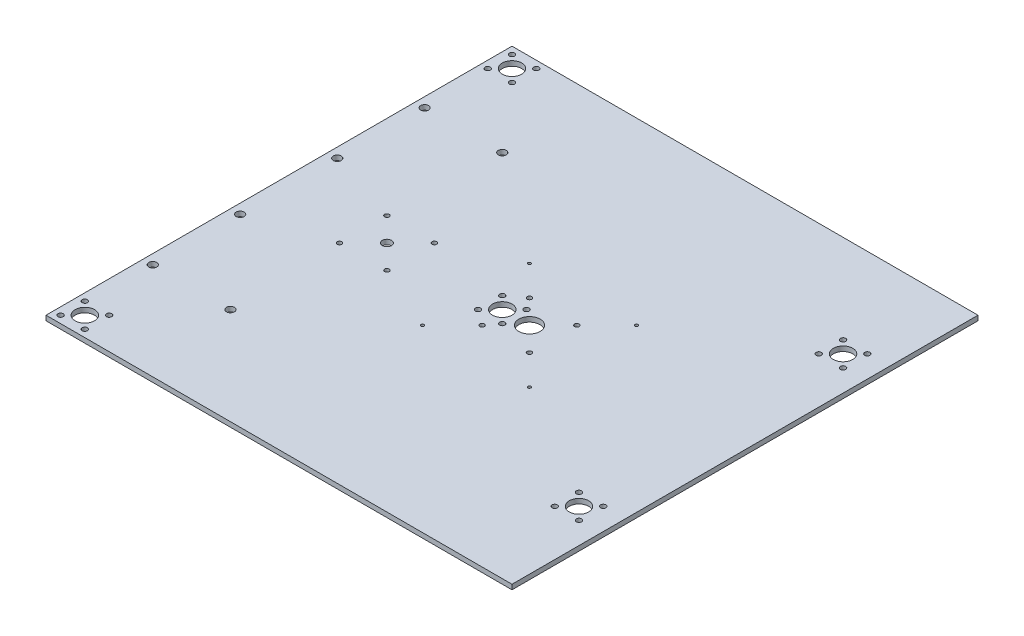
from build123d import *

# Parameters (mm, degrees)
SKETCH1_W               = 304.8
SKETCH1_H               = 304.8
BOSS_EXTRUDE1_DEPTH     = 3.175
SKETCH3_R               = 2.600000007
CUT_EXTRUDE1_DEPTH      = 216.549531721
SKETCH5_R               = 1.5
SKETCH5_R_2             = 2.999999969
CUT_EXTRUDE2_DEPTH      = 216.549531721
SKETCH7_R               = 0.999998
CUT_EXTRUDE3_DEPTH      = 216.549531721
CUT_EXTRUDE5_DEPTH      = 216.549531721
CUT_EXTRUDE5_DEPTH_BACK = 216.549531721
SKETCH9_R               = 1.726999975
SKETCH9_R_2             = 6.35
CUT_EXTRUDE6_DEPTH      = 216.549531721
CUT_EXTRUDE6_DEPTH_BACK = 216.549531721
SKETCH11_R              = 1.5
SKETCH11_R_2            = 6.985


with BuildPart() as part:
    # Sketch1 → Boss-Extrude1 (new body)
    with BuildSketch(Plane(origin=(0, 0, 0), x_dir=(1, 0, 0), z_dir=(0, 1, 0))):
        Rectangle(SKETCH1_W, SKETCH1_H)
    extrude(amount=BOSS_EXTRUDE1_DEPTH)

    # Sketch3 → Cut-Extrude1 (cut, through all)
    with BuildSketch(Plane(origin=(0, 3.175, 0), x_dir=(1, 0, 0), z_dir=(0, 1, 0))):
        with Locations((-146.05, -31.75)):
            Circle(SKETCH3_R)
        with Locations((-95.25, -88.9)):
            Circle(SKETCH3_R)
        with Locations((-146.05, -88.9)):
            Circle(SKETCH3_R)
    cut_extrude1 = extrude(amount=-CUT_EXTRUDE1_DEPTH, mode=Mode.SUBTRACT)

    # Mirror1: Cut-Extrude1 across plane
    add(cut_extrude1.mirror(Plane.XY), mode=Mode.SUBTRACT)

    # Sketch5 → Cut-Extrude2 (cut, through all)
    with BuildSketch(Plane(origin=(0, 3.175, 0), x_dir=(1, 0, 0), z_dir=(0, 1, 0))):
        with Locations((-66.312, 15.5)):
            Circle(SKETCH5_R)
        with Locations((-66.312, -15.5)):
            Circle(SKETCH5_R)
        with Locations((-97.312, 15.5)):
            Circle(SKETCH5_R)
        with Locations((-97.312, -15.5)):
            Circle(SKETCH5_R)
        with Locations((-81.812, 0)):
            Circle(SKETCH5_R_2)
    extrude(amount=-CUT_EXTRUDE2_DEPTH, mode=Mode.SUBTRACT)

    # Sketch7 → Cut-Extrude3 (cut, through all)
    with BuildSketch(Plane(origin=(0, 3.175, 0), x_dir=(1, 0, 0), z_dir=(0, 1, 0))):
        with Locations((46.431780232, -35.001797077)):
            Circle(SKETCH7_R)
        with Locations((-23.571794783, -35.001797077)):
            Circle(SKETCH7_R)
        with Locations((-23.571794783, 35.001777937)):
            Circle(SKETCH7_R)
        with Locations((46.431780232, 35.001777937)):
            Circle(SKETCH7_R)
    extrude(amount=-CUT_EXTRUDE3_DEPTH, mode=Mode.SUBTRACT)

    # Sketch9 → Cut-Extrude5 (cut, two sides: drawn at the far end of the back side and taken through both)
    with BuildSketch(Plane(origin=(0, 3.175, 0), x_dir=(1, 0, 0), z_dir=(0, 1, 0)).offset(-CUT_EXTRUDE5_DEPTH_BACK)):
        with Locations((-131.7625, -147.6375)):
            Circle(SKETCH9_R)
        with Locations((-131.7625, -131.7625)):
            Circle(SKETCH9_R)
        with Locations((-147.6375, -131.7625)):
            Circle(SKETCH9_R)
        with Locations((-147.6375, -147.6375)):
            Circle(SKETCH9_R)
        with Locations((-139.7, -139.7)):
            Circle(SKETCH9_R_2)
        with Locations((138.1125, -94.2975)):
            Circle(SKETCH9_R)
        with Locations((138.1125, -78.4225)):
            Circle(SKETCH9_R)
        with Locations((130.175, -86.36)):
            Circle(SKETCH9_R_2)
        with Locations((122.2375, -78.4225)):
            Circle(SKETCH9_R)
        with Locations((122.2375, -94.2975)):
            Circle(SKETCH9_R)
        with Locations((1.5875, 7.9375)):
            Circle(SKETCH9_R)
        with Locations((1.5875, -7.9375)):
            Circle(SKETCH9_R)
        with Locations((-6.35, 0)):
            Circle(SKETCH9_R_2)
        with Locations((-14.2875, -7.9375)):
            Circle(SKETCH9_R)
        with Locations((-14.2875, 7.9375)):
            Circle(SKETCH9_R)
        with Locations((122.2375, 94.2975)):
            Circle(SKETCH9_R)
        with Locations((122.2375, 78.4225)):
            Circle(SKETCH9_R)
        with Locations((138.1125, 94.2975)):
            Circle(SKETCH9_R)
        with Locations((130.175, 86.36)):
            Circle(SKETCH9_R_2)
        with Locations((138.1125, 78.4225)):
            Circle(SKETCH9_R)
        with Locations((-131.7625, 131.7625)):
            Circle(SKETCH9_R)
        with Locations((-131.7625, 147.6375)):
            Circle(SKETCH9_R)
        with Locations((-147.6375, 147.6375)):
            Circle(SKETCH9_R)
        with Locations((-147.6375, 131.7625)):
            Circle(SKETCH9_R)
        with Locations((-139.7, 139.7)):
            Circle(SKETCH9_R_2)
    extrude(amount=CUT_EXTRUDE5_DEPTH + CUT_EXTRUDE5_DEPTH_BACK, mode=Mode.SUBTRACT)

    # Sketch11 → Cut-Extrude6 (cut, two sides: drawn at the far end of the back side and taken through both)
    with BuildSketch(Plane(origin=(0, 3.175, 0), x_dir=(1, 0, 0), z_dir=(0, 1, 0)).offset(-CUT_EXTRUDE6_DEPTH_BACK)):
        with Locations((26.93, 15.5)):
            Circle(SKETCH11_R)
        with Locations((26.93, -15.5)):
            Circle(SKETCH11_R)
        with Locations((-4.07, -15.5)):
            Circle(SKETCH11_R)
        with Locations((-4.07, 15.5)):
            Circle(SKETCH11_R)
        with Locations((11.43, 0)):
            Circle(SKETCH11_R_2)
    extrude(amount=CUT_EXTRUDE6_DEPTH + CUT_EXTRUDE6_DEPTH_BACK, mode=Mode.SUBTRACT)


solid = part.part
